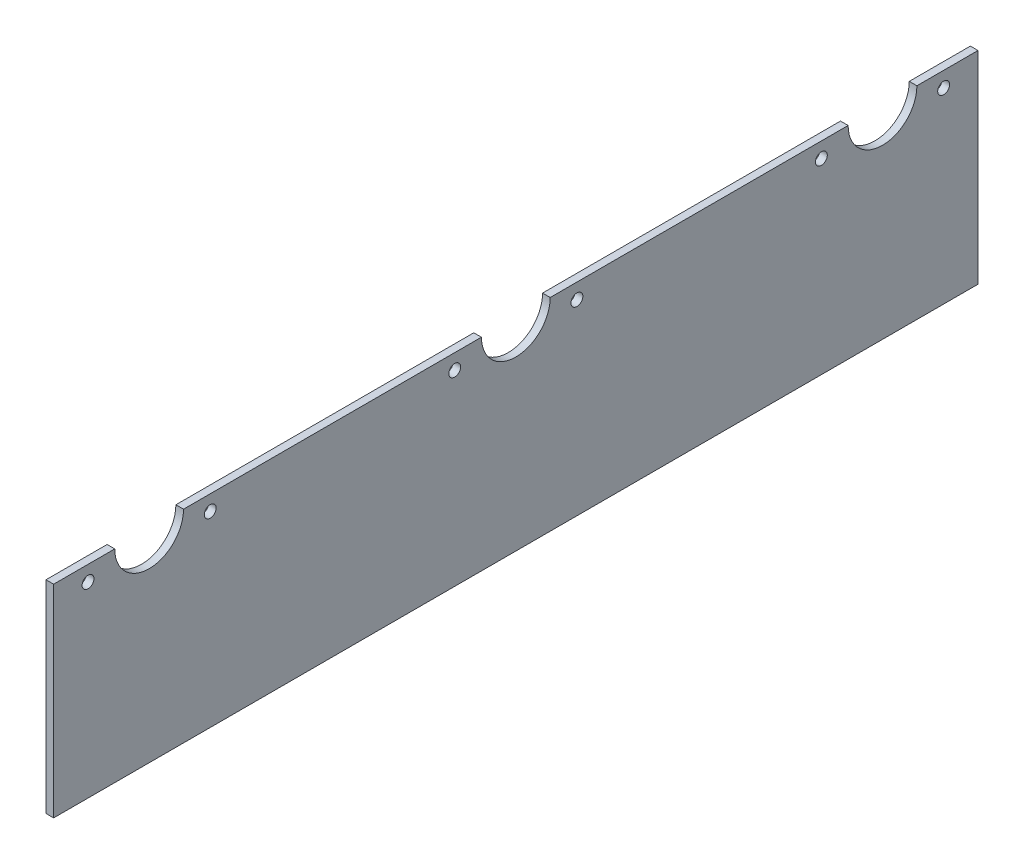
from build123d import *

# Parameters (mm, degrees)
BOSS_EXTRUDE1_DEPTH          = 3.175
F_10_0_1935_DIAMETER_HOLE1_D = 4.9149


with BuildPart() as part:
    # Sketch1 → Boss-Extrude1 (new body)
    with BuildSketch(Plane(origin=(0, 0, 0), x_dir=(0, 0, -1), z_dir=(1, 0, 0))):
        with BuildLine():
            Line((192.0875, 0), (-192.0875, 0))
            Line((-192.0875, 0), (-192.0875, 84.1375))
            Line((-192.0875, 84.1375), (-166.6875, 84.1375))
            ThreePointArc((-166.6875, 84.1375), (-152.4, 69.85), (-138.1125, 84.1375))
            Line((-138.1125, 84.1375), (-14.2875, 84.1375))
            ThreePointArc((-14.2875, 84.1375), (0, 69.85), (14.2875, 84.1375))
            Line((14.2875, 84.1375), (138.1125, 84.1375))
            ThreePointArc((138.1125, 84.1375), (152.4, 69.85), (166.6875, 84.1375))
            Line((166.6875, 84.1375), (192.0875, 84.1375))
            Line((192.0875, 84.1375), (192.0875, 0))
        make_face()
    extrude(amount=BOSS_EXTRUDE1_DEPTH)

    # #10 (0.1935) Diameter Hole1 (through all)
    with Locations(Plane(origin=(3.175, 0, 0), x_dir=(0, 0, -1), z_dir=(1, 0, 0))):
        with Locations((-177.8, 77.7875), (-127, 77.7875), (-25.4, 77.7875), (25.4, 77.7875), (127, 77.7875), (177.8, 77.7875)):
            Hole(F_10_0_1935_DIAMETER_HOLE1_D / 2)


solid = part.part
